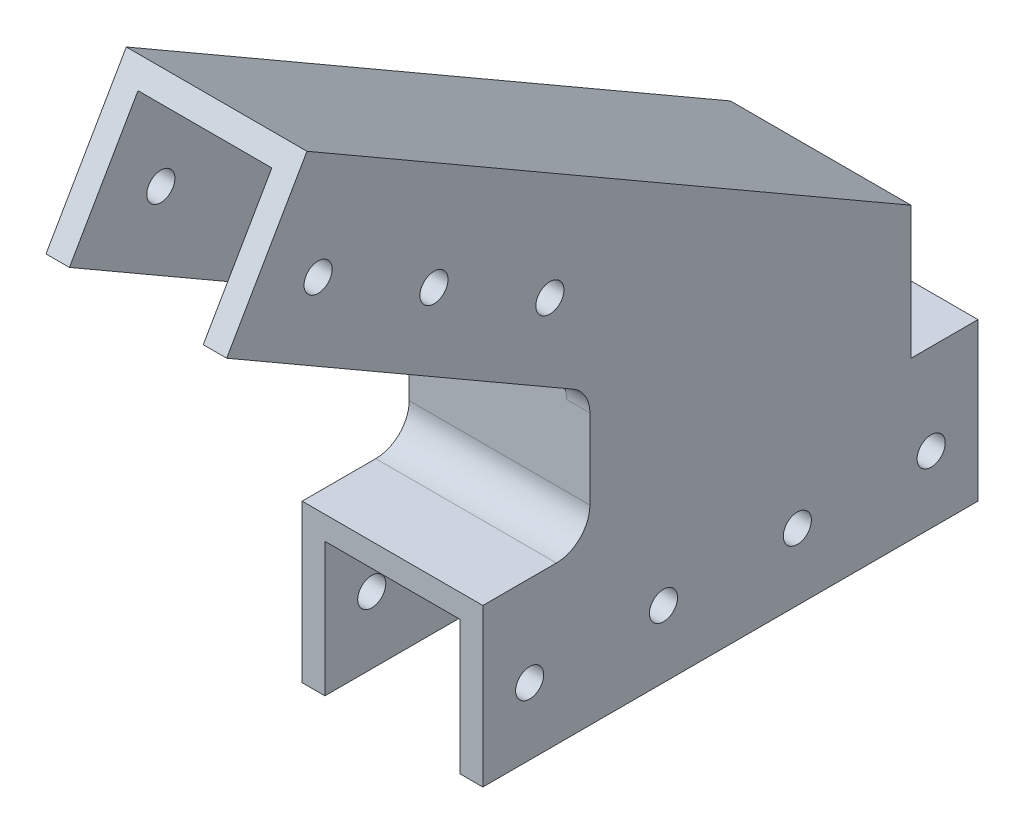
from build123d import *

# Parameters (mm, degrees)
SKETCH1_W           = 27
SKETCH1_H           = 24
BOSS_EXTRUDE1_DEPTH = 37
SHELL1_T            = -3.5
BOSS_EXTRUDE2_DEPTH = 27
SHELL2_START        = -10
SHELL2_DEPTH        = 20
SKETCH3_R           = 2.1
CUT_EXTRUDE1_DEPTH  = 116.92964185
MOVE_FACE1_BY       = 0.1
MOVE_FACE1_2_BY     = 0.1
SKETCH4_R           = 2.1
CUT_EXTRUDE2_DEPTH  = 116.92964185
FILLET1_R           = 5
SKETCH5_W           = 74
SKETCH5_H           = 0.5
CUT_EXTRUDE3_DEPTH  = 116.92964185


# Read off the part's stored shape, not the designer's step: Shell2
with BuildPart() as part:
    # Sketch1 → Boss-Extrude1 (new, symmetric)
    with BuildSketch(Plane.XY):
        Rectangle(SKETCH1_W, SKETCH1_H)
    extrude(amount=BOSS_EXTRUDE1_DEPTH, both=True)

    # Shell1
    shell1_openings = [part.faces().sort_by_distance(p)[0] for p in [
        (0, 0, 37),
        (0, 0, -37),
        (0, -12, 0),
    ]]
    offset(amount=SHELL1_T, openings=shell1_openings, kind=Kind.INTERSECTION)

    # Sketch2 → Boss-Extrude2 (add)
    with BuildSketch(Plane.ZY.offset(13.5)):
        Polygon((63.282032303, 83.924355653), (-27, 31.8), (-27, 12), (21, 12), (21, 31.8), (75.282032303, 63.139745962), align=None)
    extrude(amount=-BOSS_EXTRUDE2_DEPTH)

    # Shell2 outline → Shell2 (cut)
    with BuildSketch(Plane.YZ.offset(SHELL2_START)):
        Polygon((29.779274058, 17.5), (12, 17.5), (12, -23.5), (29.779274058, -23.5), (80.89326674, 65.032032303), (63.139745962, 75.282032303), (31.8, 21), align=None)
    extrude(amount=SHELL2_DEPTH, mode=Mode.SUBTRACT)

    # Sketch3 → Cut-Extrude1 (cut, through all)
    with BuildSketch(Plane.ZY.offset(13.5)):
        with Locations((-30, -1.5)):
            Circle(SKETCH3_R)
        with Locations((-10, -1.5)):
            Circle(SKETCH3_R)
        with Locations((10, -1.5)):
            Circle(SKETCH3_R)
        with Locations((30, -1.5)):
            Circle(SKETCH3_R)
    extrude(amount=-CUT_EXTRUDE1_DEPTH, mode=Mode.SUBTRACT)

    # Move Face1: a face moved inward by 0.1
    extrude(part.faces().sort_by_distance((10, -1.759479058, 0))[0], amount=MOVE_FACE1_BY, dir=(1, 0, 0), mode=Mode.SUBTRACT)

    # Move Face1 2: a face moved inward by 0.1
    extrude(part.faces().sort_by_distance((-10, -1.759479058, 0))[0], amount=MOVE_FACE1_2_BY, dir=(-1, 0, 0), mode=Mode.SUBTRACT)

    # Sketch4 → Cut-Extrude2 (cut, through all)
    with BuildSketch(Plane.ZY.offset(13.5)):
        with Locations((61.621778265, 66.8)):
            Circle(SKETCH4_R)
        with Locations((44.301270189, 56.8)):
            Circle(SKETCH4_R)
        with Locations((26.980762114, 46.8)):
            Circle(SKETCH4_R)
    extrude(amount=-CUT_EXTRUDE2_DEPTH, mode=Mode.SUBTRACT)

    # Fillet1
    fillet1_edges = [part.edges().sort_by_distance(p)[0] for p in [
        (11.75, 31.8, 21),
        (0, 12, 21),
        (-11.75, 31.8, 21),
    ]]
    fillet(fillet1_edges, radius=FILLET1_R)

    # Sketch5 → Cut-Extrude3 (cut, through all)
    with BuildSketch(Plane.ZY.offset(13.5)):
        with Locations((0, -11.75)):
            Rectangle(SKETCH5_W, SKETCH5_H)
    extrude(amount=-CUT_EXTRUDE3_DEPTH, mode=Mode.SUBTRACT)


solid = part.part
